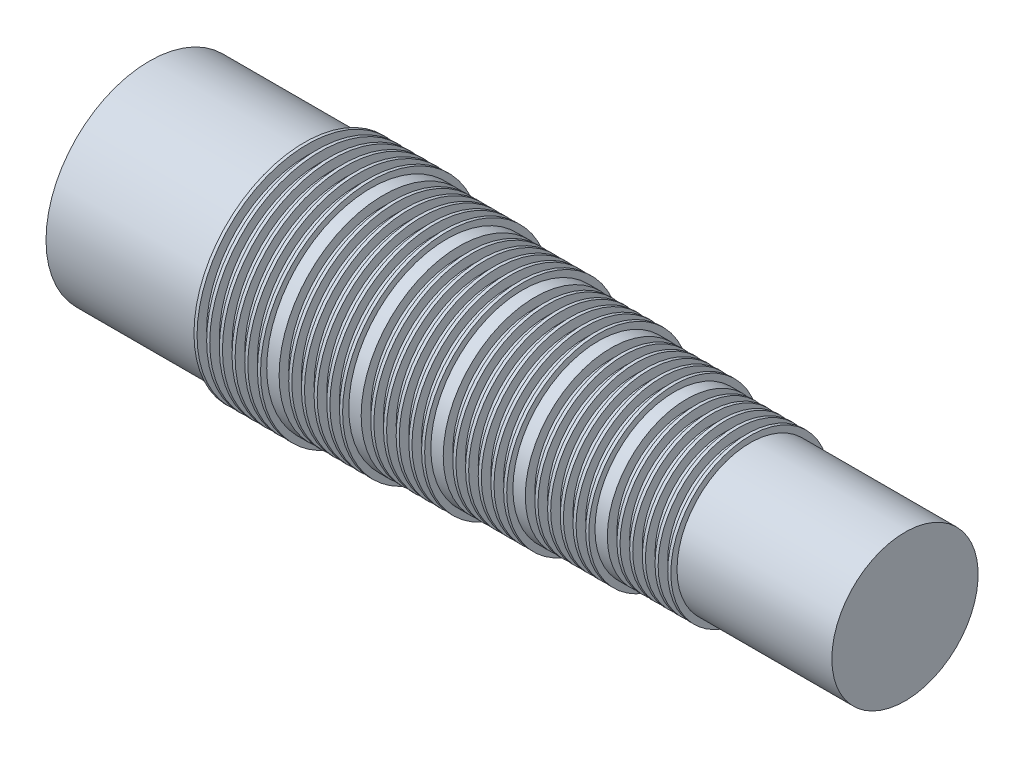
from build123d import *


with BuildPart() as part:
    # Sketch1 → Revolve1 (revolve)
    with BuildSketch(Plane.XY):
        Polygon((12.954, 9.047988), (12.954, 8.260588), (13.7414, 8.260588), (13.7414, 9.047988), (13.9954, 9.047988), (13.9954, 8.260588), (14.7828, 8.260588), (14.7828, 9.047988), (15.0368, 9.047988), (15.0368, 8.260588), (15.8242, 8.260588), (15.8242, 9.047988), (16.0782, 9.047988), (16.0782, 8.260588), (16.8656, 8.260588), (16.8656, 9.047988), (17.1196, 9.047988), (17.1196, 8.260588), (17.907, 8.260588), (17.907, 9.047988), (18.161, 9.047988), (18.161, 8.539988), (19.177, 8.539988), (19.177, 7.752588), (19.9644, 7.752588), (19.9644, 8.539988), (20.2184, 8.539988), (20.2184, 7.752588), (21.0058, 7.752588), (21.0058, 8.539988), (21.2598, 8.539988), (21.2598, 7.752588), (22.0472, 7.752588), (22.0472, 8.539988), (22.3012, 8.539988), (22.3012, 7.752588), (23.0886, 7.752588), (23.0886, 8.539988), (23.3426, 8.539988), (23.3426, 7.752588), (24.13, 7.752588), (24.13, 8.539988), (24.384, 8.539988), (24.384, 8.031988), (25.4, 8.031988), (25.4, 7.244588), (26.1874, 7.244588), (26.1874, 8.031988), (26.4414, 8.031988), (26.4414, 7.244588), (27.2288, 7.244588), (27.2288, 8.031988), (27.4828, 8.031988), (27.4828, 7.244588), (28.2702, 7.244588), (28.2702, 8.031988), (28.5242, 8.031988), (28.5242, 7.244588), (29.3116, 7.244588), (29.3116, 8.031988), (29.5656, 8.031988), (29.5656, 7.244588), (30.353, 7.244588), (30.353, 8.031988), (30.607, 8.031988), (30.607, 7.523988), (31.623, 7.523988), (31.623, 6.736588), (32.4104, 6.736588), (32.4104, 7.523988), (32.6644, 7.523988), (32.6644, 6.736588), (33.4518, 6.736588), (33.4518, 7.523988), (33.7058, 7.523988), (33.7058, 6.736588), (34.4932, 6.736588), (34.4932, 7.523988), (34.7472, 7.523988), (34.7472, 6.736588), (35.5346, 6.736588), (35.5346, 7.523988), (35.7886, 7.523988), (35.7886, 6.736588), (36.576, 6.736588), (36.576, 7.523988), (36.83, 7.523988), (36.83, 7.015988), (37.846, 7.015988), (37.846, 6.228588), (38.6334, 6.228588), (38.6334, 7.015988), (38.8874, 7.015988), (38.8874, 6.228588), (39.6748, 6.228588), (39.6748, 7.015988), (39.9288, 7.015988), (39.9288, 6.228588), (40.7162, 6.228588), (40.7162, 7.015988), (40.9702, 7.015988), (40.9702, 6.228588), (41.7576, 6.228588), (41.7576, 7.015988), (42.0116, 7.015988), (42.0116, 6.228588), (42.799, 6.228588), (42.799, 7.015988), (43.053, 7.015988), (43.053, 6.507988), (44.069, 6.507988), (44.069, 5.720588), (44.8564, 5.720588), (44.8564, 6.507988), (45.1104, 6.507988), (45.1104, 5.720588), (45.8978, 5.720588), (45.8978, 6.507988), (46.1518, 6.507988), (46.1518, 5.720588), (46.9392, 5.720588), (46.9392, 6.507988), (47.1932, 6.507988), (47.1932, 5.720588), (47.9806, 5.720588), (47.9806, 6.507988), (48.2346, 6.507988), (48.2346, 5.720588), (49.022, 5.720588), (49.022, 6.507988), (49.276, 6.507988), (49.276, 5.999988), (61.976, 5.999988), (61.976, 0), (0, 0), (0, 8.4836), (12.7, 8.4836), (12.7, 9.047988), align=None)
    revolve(axis=Axis((0, 0, 0), (1, 0, 0)))


solid = part.part
